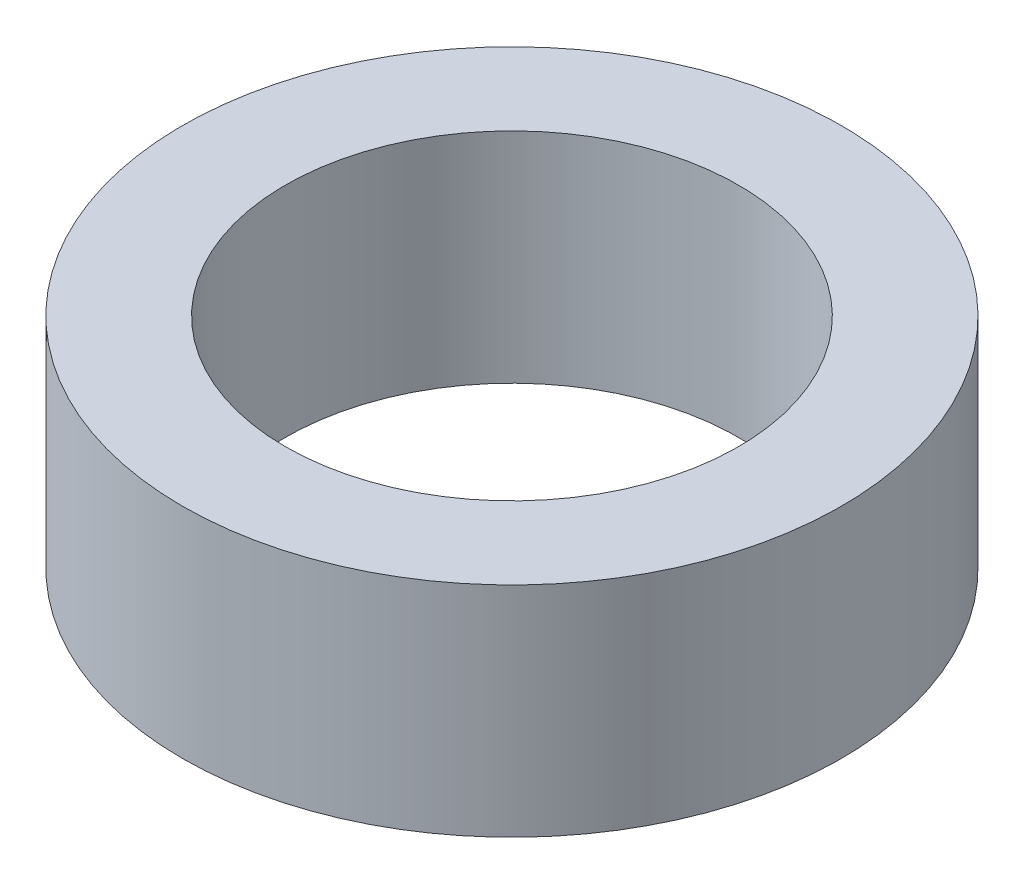
from build123d import *

# Parameters (mm, degrees)
SKETCH1_R           = 9.2
SKETCH1_R_2         = 6.325
BOSS_EXTRUDE1_DEPTH = 6.1


with BuildPart() as part:
    # Sketch1 → Boss-Extrude1 (new body)
    with BuildSketch(Plane(origin=(0, 0, 0), x_dir=(1, 0, 0), z_dir=(0, 1, 0))):
        Circle(SKETCH1_R)
        Circle(SKETCH1_R_2, mode=Mode.SUBTRACT)
    extrude(amount=BOSS_EXTRUDE1_DEPTH)


solid = part.part
